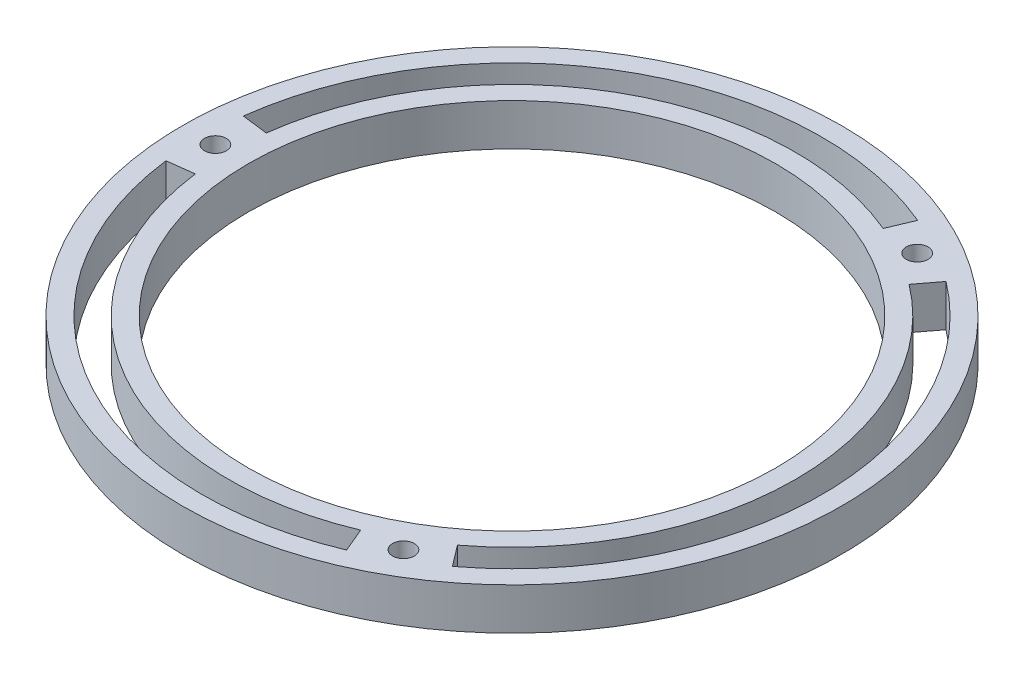
from build123d import *

# Parameters (mm, degrees)
SKETCH1_R           = 50
SKETCH1_R_2         = 40
BOSS_EXTRUDE1_DEPTH = 6.35
M3_HOLES_REACH      = 72.995
SKETCH2_R           = 1.65


with BuildPart() as part:
    # Sketch1 → Boss-Extrude1 (new body)
    with BuildSketch(Plane(origin=(0, 0, 0), x_dir=(1, 0, 0), z_dir=(0, 1, 0))):
        Circle(SKETCH1_R)
        with BuildLine():
            Line((28.403582676, -37.446448312), (25.986256491, -34.259516541))
            ThreePointArc((25.986256491, -34.259516541), (43, 0), (25.986256491, 34.259516541))
            Line((25.986256491, 34.259516541), (28.403582676, 37.446448312))
            ThreePointArc((28.403582676, 37.446448312), (47, 0), (28.403582676, -37.446448312))
        make_face(mode=Mode.SUBTRACT)
        with BuildLine():
            ThreePointArc((18.227784182, -43.321448312), (-23.5, -40.703193978), (-46.631366858, -5.875))
            Line((-46.631366858, -5.875), (-42.662739891, -5.375))
            ThreePointArc((-42.662739891, -5.375), (-21.5, -37.239092363), (16.6764834, -39.634516541))
            Line((16.6764834, -39.634516541), (18.227784182, -43.321448312))
        make_face(mode=Mode.SUBTRACT)
        with BuildLine():
            Line((18.227784182, 43.321448312), (16.6764834, 39.634516541))
            ThreePointArc((16.6764834, 39.634516541), (-21.5, 37.239092363), (-42.662739891, 5.375))
            Line((-42.662739891, 5.375), (-46.631366858, 5.875))
            ThreePointArc((-46.631366858, 5.875), (-23.5, 40.703193978), (18.227784182, 43.321448312))
        make_face(mode=Mode.SUBTRACT)
        Circle(SKETCH1_R_2, mode=Mode.SUBTRACT)
    extrude(amount=BOSS_EXTRUDE1_DEPTH)

    # Sketch2 → M3-holes (cut, up to next)
    with BuildSketch(Plane(origin=(0, 6.35, 0), x_dir=(1, 0, 0), z_dir=(0, 1, 0)), mode=Mode.PRIVATE) as m3_holes_sk1:
        with Locations((-45, 0)):
            Circle(SKETCH2_R)
    m3_holes_tool1 = extrude(m3_holes_sk1.sketch, amount=-M3_HOLES_REACH, mode=Mode.PRIVATE) & part.part
    # Sketch2 → M3-holes (cut, up to next)
    with BuildSketch(Plane(origin=(0, 6.35, 0), x_dir=(1, 0, 0), z_dir=(0, 1, 0)), mode=Mode.PRIVATE) as m3_holes_sk2:
        with Locations((22.5, -38.97114317)):
            Circle(SKETCH2_R)
    m3_holes_tool2 = extrude(m3_holes_sk2.sketch, amount=-M3_HOLES_REACH, mode=Mode.PRIVATE) & part.part
    # Sketch2 → M3-holes (cut, up to next)
    with BuildSketch(Plane(origin=(0, 6.35, 0), x_dir=(1, 0, 0), z_dir=(0, 1, 0)), mode=Mode.PRIVATE) as m3_holes_sk3:
        with Locations((22.5, 38.97114317)):
            Circle(SKETCH2_R)
    m3_holes_tool3 = extrude(m3_holes_sk3.sketch, amount=-M3_HOLES_REACH, mode=Mode.PRIVATE) & part.part
    add(m3_holes_tool1.solids().sort_by_distance((-45, 6.35, 0))[0], mode=Mode.SUBTRACT)
    add(m3_holes_tool2.solids().sort_by_distance((22.5, 6.35, 38.971143))[0], mode=Mode.SUBTRACT)
    add(m3_holes_tool3.solids().sort_by_distance((22.5, 6.35, -38.971143))[0], mode=Mode.SUBTRACT)


solid = part.part
